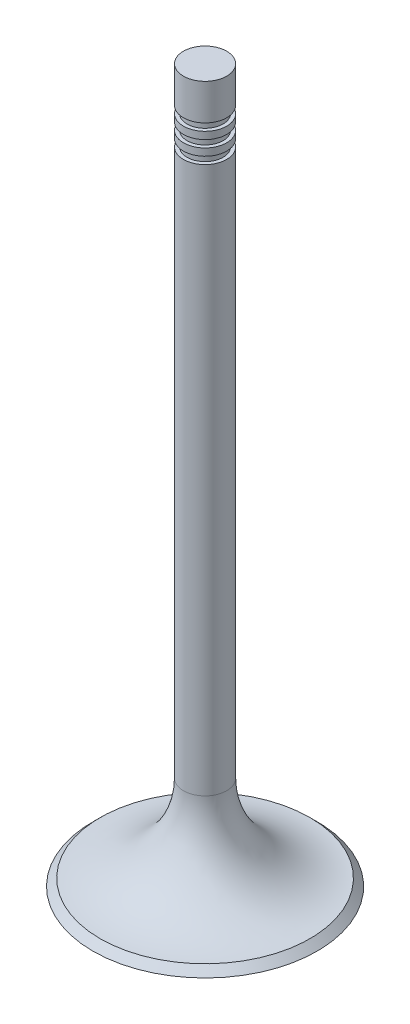
from build123d import *

# Parameters (mm, degrees)
SKETCH1_R           = 15.55
BOSS_EXTRUDE1_DEPTH = 1
CHAMFER2_SIZE       = 1
SKETCH4_R           = 3
BOSS_EXTRUDE2_DEPTH = 97.8
FILLET1_R           = 12
SKETCH5_W           = 0.5
SKETCH5_H           = 1


# Some blends are built 0.0001 mm under size
with BuildPart() as part:
    # Sketch1 → Boss-Extrude1 (new body)
    with BuildSketch(Plane(origin=(0, 0, 0), x_dir=(1, 0, 0), z_dir=(0, 1, 0))):
        with Locations(Location((0, 0, 0), (0, 0, 270))):
            Circle(SKETCH1_R)
    extrude(amount=BOSS_EXTRUDE1_DEPTH)

    # Chamfer2
    chamfer2_edges = [part.edges().sort_by_distance(p)[0] for p in [
        (0, 1, -15.55),
    ]]
    chamfer(chamfer2_edges, length=CHAMFER2_SIZE - 0.0001)  # a hair under: the kernel refuses the full size

    # Sketch4 → Boss-Extrude2 (add)
    with BuildSketch(Plane(origin=(0, 1, 0), x_dir=(1, 0, 0), z_dir=(0, 1, 0))):
        with Locations(Location((0, 0, 0), (0, 0, 270))):
            Circle(SKETCH4_R)
    extrude(amount=BOSS_EXTRUDE2_DEPTH)

    # Fillet1
    # the kernel refuses this fillet: 12 mm, written as the material it adds along each edge
    with BuildSketch(Plane(origin=(0, 1, 0), x_dir=(0, 0, 1), z_dir=(-1, 0, 0))) as fillet1_piece_1:
        with BuildLine():
            CenterArc((15, 11.991563284), FILLET1_R, 180, 87.851382174)
            Line((3, 11.991563284), (2.76, 11.991563284))
            Line((2.76, 11.991563284), (2.76, 0))
            Line((2.76, 0), (3, -0.24))
            ThreePointArc((3, -0.24), (8.77505, -0.24), (14.541102, -0.239831266))
            Line((14.541102, -0.239831266), (14.5501, 0))
        make_face()
    revolve(axis=Axis((0, 1, 0), (0, 1, 0)))

    # Sketch5 → Cut-Revolve1 (revolve, cut)
    with BuildSketch(Plane.XY, mode=Mode.PRIVATE) as cut_revolve1_sk:
        with Locations((-2.75, 93.3)):
            Rectangle(SKETCH5_W, SKETCH5_H)
        with Locations((-2.75, 91.3)):
            Rectangle(SKETCH5_W, SKETCH5_H)
        with Locations((-2.75, 89.3)):
            Rectangle(SKETCH5_W, SKETCH5_H)
    revolve(cut_revolve1_sk.sketch.rotate(Axis((0, 98.8, 0), (0, -1, 0)), 270), axis=Axis((0, 98.8, 0), (0, -1, 0)), mode=Mode.SUBTRACT)


solid = part.part
